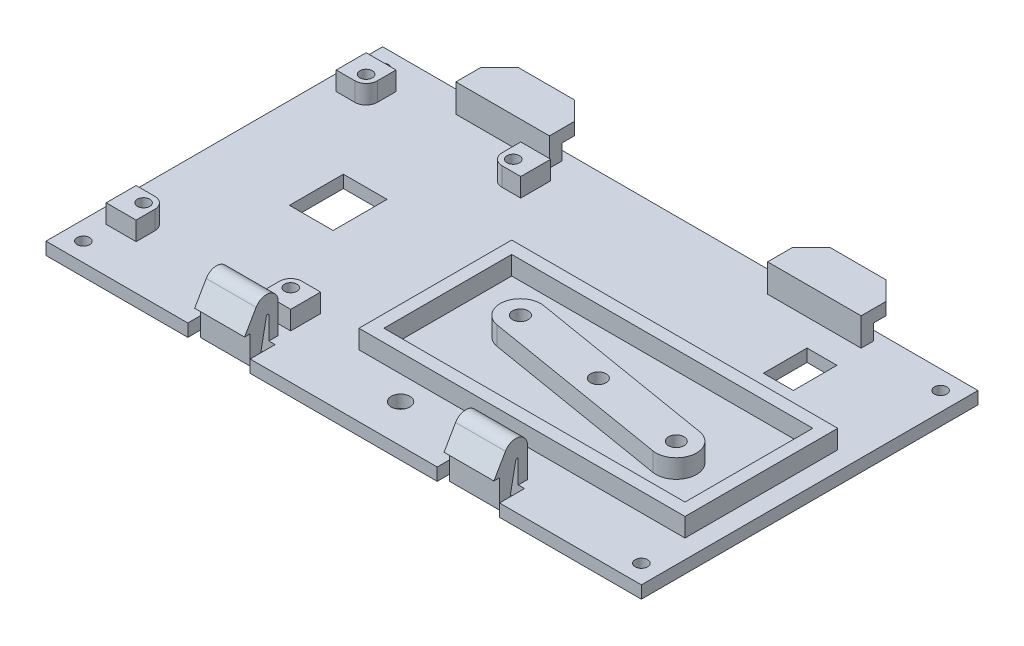
from build123d import *

# Parameters (mm, degrees)
SKETCH1_W            = 95.5
SKETCH1_H            = 54
BOSS_EXTRUDE1_DEPTH  = 2
SKETCH2_W            = 15
SKETCH2_H            = 2
BOSS_EXTRUDE2_DEPTH  = 2.5
SKETCH3_W            = 15
SKETCH3_H            = 7
BOSS_EXTRUDE3_DEPTH  = 2
CHAMFER1_SIZE        = 3
CUT_EXTRUDE1_REACH   = 59.031
SKETCH4_W            = 10
SKETCH4_H            = 4
BOSS_EXTRUDE4_DEPTH  = 4
FILLET1_R            = 1.901924
FILLET2_R            = 0.2
FILLET1_OF_MIRROR1_R = 1.901924
FILLET2_OF_MIRROR1_R = 0.2
CUT_EXTRUDE5_REACH   = 59.049
SKETCH12_R           = 1.5
SKETCH12_R_2         = 1
CUT_EXTRUDE6_REACH   = 59.049
SKETCH13_W           = 4.8
SKETCH13_H           = 7
CUT_EXTRUDE2_REACH   = 59.317
SKETCH8_W            = 7
SKETCH8_H            = 8.65
BOSS_EXTRUDE5_DEPTH  = 3
CUT_EXTRUDE3_REACH   = 60.049
CUT_EXTRUDE3_START   = 1
SKETCH9_3_R          = 1
SKETCH10_W           = 52.3
SKETCH10_H           = 24.5
SKETCH10_W_2         = 48.3
SKETCH10_H_2         = 20.5
BOSS_EXTRUDE6_DEPTH  = 3
CUT_EXTRUDE4_REACH   = 60.049
CUT_EXTRUDE4_START   = 1
SKETCH10_4_R         = 1.25


with BuildPart() as part:
    # Sketch1 → Boss-Extrude1 (new body)
    with BuildSketch(Plane(origin=(0, 0, 0), x_dir=(1, 0, 0), z_dir=(0, 1, 0))):
        Rectangle(SKETCH1_W, SKETCH1_H)
    extrude(amount=BOSS_EXTRUDE1_DEPTH)

    # Sketch2 → Boss-Extrude2 (add)
    with BuildSketch(Plane.XZ.offset(-2)):
        with Locations((-25, -24.5)):
            Rectangle(SKETCH2_W, SKETCH2_H)
        with Locations((25, -24.5)):
            Rectangle(SKETCH2_W, SKETCH2_H)
    extrude(amount=-BOSS_EXTRUDE2_DEPTH)

    # Sketch3 → Boss-Extrude3 (add)
    with BuildSketch(Plane(origin=(0, 4.5, 0), x_dir=(-1, 0, 0), z_dir=(0, 1, 0))):
        with Locations((-25, -27)):
            Rectangle(SKETCH3_W, SKETCH3_H)
        with Locations((25, -27)):
            Rectangle(SKETCH3_W, SKETCH3_H)
    extrude(amount=BOSS_EXTRUDE3_DEPTH)

    # Chamfer1
    chamfer1_edges = [part.edges().sort_by_distance(p)[0] for p in [
        (32.5, 5.5, -30.5),
        (17.5, 5.5, -30.5),
        (-17.5, 5.5, -30.5),
        (-32.5, 5.5, -30.5),
    ]]
    chamfer(chamfer1_edges, length=CHAMFER1_SIZE)

    # Sketch4 → Cut-Extrude1 (cut, up to next)
    with BuildSketch(Plane.XZ, mode=Mode.PRIVATE) as cut_extrude1_sk1:
        with Locations((-20, 25)):
            Rectangle(SKETCH4_W, SKETCH4_H)
    cut_extrude1_tool1 = extrude(cut_extrude1_sk1.sketch, amount=-CUT_EXTRUDE1_REACH, mode=Mode.PRIVATE) & part.part
    # Sketch4 → Cut-Extrude1 (cut, up to next)
    with BuildSketch(Plane.XZ, mode=Mode.PRIVATE) as cut_extrude1_sk2:
        with Locations((20, 25)):
            Rectangle(SKETCH4_W, SKETCH4_H)
    cut_extrude1_tool2 = extrude(cut_extrude1_sk2.sketch, amount=-CUT_EXTRUDE1_REACH, mode=Mode.PRIVATE) & part.part
    add(cut_extrude1_tool1.solids().sort_by_distance((-20, 0, 25))[0], mode=Mode.SUBTRACT)
    add(cut_extrude1_tool2.solids().sort_by_distance((20, 0, 25))[0], mode=Mode.SUBTRACT)

    # Sketch6 → Boss-Extrude4 (add, symmetric)
    with BuildSketch(Plane(origin=(-20, 0, 0), x_dir=(0, 0, -1), z_dir=(1, 0, 0))):
        Polygon((-21.5, 2), (-21.5, 8.656921938), (-24.5, 8.656921938), (-26, 6.058845727), (-26.9, 4.5), (-26, 4.5), (-26, 0), (-24.5, 0), (-23, 7.656921938), (-23, 2), align=None)
    boss_extrude4 = extrude(amount=BOSS_EXTRUDE4_DEPTH, both=True)

    # Fillet1
    fillet1_edges = [part.edges().sort_by_distance(p)[0] for p in [
        (-20, 8.656921938, 21.5),
        (-20, 8.656921938, 24.5),
    ]]
    fillet(fillet1_edges, radius=FILLET1_R - 0.0001)  # a hair under: the kernel refuses the full size

    # Fillet2
    fillet2_edges = [part.edges().sort_by_distance(p)[0] for p in [
        (-20, 7.656921938, 23),
    ]]
    fillet(fillet2_edges, radius=FILLET2_R)

    # Mirror1: Boss-Extrude4 across plane
    add(boss_extrude4.mirror(Plane(origin=(0, 0, 0), x_dir=(0, 0, 1), z_dir=(1, 0, 0))))

    # Fillet1 of Mirror1
    fillet1_of_mirror1_edges = [part.edges().sort_by_distance(p)[0] for p in [
        (20, 8.656921938, 21.5),
        (20, 8.656921938, 24.5),
    ]]
    fillet(fillet1_of_mirror1_edges, radius=FILLET1_OF_MIRROR1_R - 0.0001)  # a hair under: the kernel refuses the full size

    # Fillet2 of Mirror1
    fillet2_of_mirror1_edges = [part.edges().sort_by_distance(p)[0] for p in [
        (20, 7.656921938, 23),
    ]]
    fillet(fillet2_of_mirror1_edges, radius=FILLET2_OF_MIRROR1_R)

    # Sketch12 → Cut-Extrude5 (cut, up to next)
    with BuildSketch(Plane(origin=(0, 2, 0), x_dir=(1, 0, 0), z_dir=(0, 1, 0)), mode=Mode.PRIVATE) as cut_extrude5_sk1:
        with Locations(Location((2.9867, -20.8641, 0), (0, 0, 270))):
            Circle(SKETCH12_R)
    cut_extrude5_tool1 = extrude(cut_extrude5_sk1.sketch, amount=-CUT_EXTRUDE5_REACH, mode=Mode.PRIVATE) & part.part
    # Sketch12 → Cut-Extrude5 (cut, up to next)
    with BuildSketch(Plane(origin=(0, 2, 0), x_dir=(1, 0, 0), z_dir=(0, 1, 0)), mode=Mode.PRIVATE) as cut_extrude5_sk2:
        with Locations(Location((-44.75, -24, 0), (0, 0, 270))):
            Circle(SKETCH12_R_2)
    cut_extrude5_tool2 = extrude(cut_extrude5_sk2.sketch, amount=-CUT_EXTRUDE5_REACH, mode=Mode.PRIVATE) & part.part
    # Sketch12 → Cut-Extrude5 (cut, up to next)
    with BuildSketch(Plane(origin=(0, 2, 0), x_dir=(1, 0, 0), z_dir=(0, 1, 0)), mode=Mode.PRIVATE) as cut_extrude5_sk3:
        with Locations(Location((44.75, -24, 0), (0, 0, 270))):
            Circle(SKETCH12_R_2)
    cut_extrude5_tool3 = extrude(cut_extrude5_sk3.sketch, amount=-CUT_EXTRUDE5_REACH, mode=Mode.PRIVATE) & part.part
    # Sketch12 → Cut-Extrude5 (cut, up to next)
    with BuildSketch(Plane(origin=(0, 2, 0), x_dir=(1, 0, 0), z_dir=(0, 1, 0)), mode=Mode.PRIVATE) as cut_extrude5_sk4:
        with Locations(Location((-44.75, 24, 0), (0, 0, 270))):
            Circle(SKETCH12_R_2)
    cut_extrude5_tool4 = extrude(cut_extrude5_sk4.sketch, amount=-CUT_EXTRUDE5_REACH, mode=Mode.PRIVATE) & part.part
    # Sketch12 → Cut-Extrude5 (cut, up to next)
    with BuildSketch(Plane(origin=(0, 2, 0), x_dir=(1, 0, 0), z_dir=(0, 1, 0)), mode=Mode.PRIVATE) as cut_extrude5_sk5:
        with Locations(Location((44.75, 24, 0), (0, 0, 270))):
            Circle(SKETCH12_R_2)
    cut_extrude5_tool5 = extrude(cut_extrude5_sk5.sketch, amount=-CUT_EXTRUDE5_REACH, mode=Mode.PRIVATE) & part.part
    add(cut_extrude5_tool1.solids().sort_by_distance((2.9867, 2, 20.8641))[0], mode=Mode.SUBTRACT)
    add(cut_extrude5_tool2.solids().sort_by_distance((-44.75, 2, 24))[0], mode=Mode.SUBTRACT)
    add(cut_extrude5_tool3.solids().sort_by_distance((44.75, 2, 24))[0], mode=Mode.SUBTRACT)
    add(cut_extrude5_tool4.solids().sort_by_distance((-44.75, 2, -24))[0], mode=Mode.SUBTRACT)
    add(cut_extrude5_tool5.solids().sort_by_distance((44.75, 2, -24))[0], mode=Mode.SUBTRACT)

    # Sketch13 → Cut-Extrude6 (cut, up to next)
    with BuildSketch(Plane(origin=(0, 2, 0), x_dir=(1, 0, 0), z_dir=(0, 1, 0)), mode=Mode.PRIVATE) as cut_extrude6_sk1:
        with Locations((30.5407, 15.6841)):
            Rectangle(SKETCH13_W, SKETCH13_H)
    cut_extrude6_tool1 = extrude(cut_extrude6_sk1.sketch, amount=-CUT_EXTRUDE6_REACH, mode=Mode.PRIVATE) & part.part
    add(cut_extrude6_tool1.solids().sort_by_distance((30.5407, 2, -15.6841))[0], mode=Mode.SUBTRACT)

    # Sketch8 → Cut-Extrude2 (cut, up to next)
    with BuildSketch(Plane.XZ, mode=Mode.PRIVATE) as cut_extrude2_sk1:
        with Locations((-29.7, -1.825)):
            Rectangle(SKETCH8_W, SKETCH8_H)
    cut_extrude2_tool1 = extrude(cut_extrude2_sk1.sketch, amount=-CUT_EXTRUDE2_REACH, mode=Mode.PRIVATE) & part.part
    add(cut_extrude2_tool1.solids().sort_by_distance((-29.7, 0, -1.825))[0], mode=Mode.SUBTRACT)

    # Sketch9 → Boss-Extrude5 (add)
    with BuildSketch(Plane(origin=(0, 2, 0), x_dir=(1, 0, 0), z_dir=(0, 1, 0))):
        with BuildLine():
            Line((-45.25, -15.05), (-45.25, -19.85))
            Line((-45.25, -19.85), (-40.45, -19.85))
            Line((-40.45, -19.85), (-40.45, -16.85))
            ThreePointArc((-40.45, -16.85), (-40.977207794, -15.577207794), (-42.25, -15.05))
            Line((-42.25, -15.05), (-45.25, -15.05))
        make_face()
        with BuildLine():
            Line((-15.65, -15.05), (-18.65, -15.05))
            ThreePointArc((-18.65, -15.05), (-19.922792206, -15.577207794), (-20.45, -16.85))
            Line((-20.45, -16.85), (-20.45, -19.85))
            Line((-20.45, -19.85), (-15.65, -19.85))
            Line((-15.65, -19.85), (-15.65, -15.05))
        make_face()
        with BuildLine():
            Line((-45.25, 17.05), (-42.25, 17.05))
            ThreePointArc((-42.25, 17.05), (-40.977207794, 17.577207794), (-40.45, 18.85))
            Line((-40.45, 18.85), (-40.45, 21.85))
            Line((-40.45, 21.85), (-45.25, 21.85))
            Line((-45.25, 21.85), (-45.25, 17.05))
        make_face()
        with BuildLine():
            Line((-15.65, 17.05), (-15.65, 21.85))
            Line((-15.65, 21.85), (-20.45, 21.85))
            Line((-20.45, 21.85), (-20.45, 18.85))
            ThreePointArc((-20.45, 18.85), (-19.922792206, 17.577207794), (-18.65, 17.05))
            Line((-18.65, 17.05), (-15.65, 17.05))
        make_face()
    extrude(amount=BOSS_EXTRUDE5_DEPTH)

    # Sketch9<3> → Cut-Extrude3 (cut, up to next)
    with BuildSketch(Plane(origin=(0, 2, 0), x_dir=(1, 0, 0), z_dir=(0, 1, 0)).offset(CUT_EXTRUDE3_START), mode=Mode.PRIVATE) as cut_extrude3_sk1:
        with Locations(Location((-42.25, -16.85, 0), (0, 0, 270))):
            Circle(SKETCH9_3_R)
    cut_extrude3_tool1 = extrude(cut_extrude3_sk1.sketch, amount=CUT_EXTRUDE3_REACH, mode=Mode.PRIVATE) & part.part
    # Sketch9<3> → Cut-Extrude3 (cut, up to next)
    with BuildSketch(Plane(origin=(0, 2, 0), x_dir=(1, 0, 0), z_dir=(0, 1, 0)).offset(CUT_EXTRUDE3_START), mode=Mode.PRIVATE) as cut_extrude3_sk2:
        with Locations(Location((-18.65, -16.85, 0), (0, 0, 90))):
            Circle(SKETCH9_3_R)
    cut_extrude3_tool2 = extrude(cut_extrude3_sk2.sketch, amount=CUT_EXTRUDE3_REACH, mode=Mode.PRIVATE) & part.part
    # Sketch9<3> → Cut-Extrude3 (cut, up to next)
    with BuildSketch(Plane(origin=(0, 2, 0), x_dir=(1, 0, 0), z_dir=(0, 1, 0)).offset(CUT_EXTRUDE3_START), mode=Mode.PRIVATE) as cut_extrude3_sk3:
        with Locations(Location((-42.25, 18.85, 0), (0, 0, 90))):
            Circle(SKETCH9_3_R)
    cut_extrude3_tool3 = extrude(cut_extrude3_sk3.sketch, amount=CUT_EXTRUDE3_REACH, mode=Mode.PRIVATE) & part.part
    # Sketch9<3> → Cut-Extrude3 (cut, up to next)
    with BuildSketch(Plane(origin=(0, 2, 0), x_dir=(1, 0, 0), z_dir=(0, 1, 0)).offset(CUT_EXTRUDE3_START), mode=Mode.PRIVATE) as cut_extrude3_sk4:
        with Locations(Location((-18.65, 18.85, 0), (0, 0, 270))):
            Circle(SKETCH9_3_R)
    cut_extrude3_tool4 = extrude(cut_extrude3_sk4.sketch, amount=CUT_EXTRUDE3_REACH, mode=Mode.PRIVATE) & part.part
    add(cut_extrude3_tool1.solids().sort_by_distance((-42.25, 3, 16.85))[0], mode=Mode.SUBTRACT)
    add(cut_extrude3_tool2.solids().sort_by_distance((-18.65, 3, 16.85))[0], mode=Mode.SUBTRACT)
    add(cut_extrude3_tool3.solids().sort_by_distance((-42.25, 3, -18.85))[0], mode=Mode.SUBTRACT)
    add(cut_extrude3_tool4.solids().sort_by_distance((-18.65, 3, -18.85))[0], mode=Mode.SUBTRACT)

    # Sketch10 → Boss-Extrude6 (add)
    # profile 1 of 2: a face of its own
    with BuildSketch(Plane(origin=(0, 2, 0), x_dir=(1, 0, 0), z_dir=(0, 1, 0))):
        with Locations((18.6, -4.75)):
            Rectangle(SKETCH10_W, SKETCH10_H)
        with Locations((18.6, -4.75)):
            Rectangle(SKETCH10_W_2, SKETCH10_H_2, mode=Mode.SUBTRACT)
    # profile 2 of 2: a face of its own
    with BuildSketch(Plane(origin=(0, 2, 0), x_dir=(1, 0, 0), z_dir=(0, 1, 0))):
        with BuildLine():
            Line((4.134296709, 0.955780252), (34.134296709, -4.044219748))
            ThreePointArc((34.134296709, -4.044219748), (36.805780252, -7.784296709), (33.065703291, -10.455780252))
            Line((33.065703291, -10.455780252), (3.065703291, -5.455780252))
            ThreePointArc((3.065703291, -5.455780252), (0.394219748, -1.715703291), (4.134296709, 0.955780252))
        make_face()
    extrude(amount=BOSS_EXTRUDE6_DEPTH)

    # Sketch10<4> → Cut-Extrude4 (cut, up to next)
    with BuildSketch(Plane(origin=(0, 2, 0), x_dir=(1, 0, 0), z_dir=(0, 1, 0)).offset(CUT_EXTRUDE4_START), mode=Mode.PRIVATE) as cut_extrude4_sk1:
        with Locations(Location((18.6, -4.75, 0), (0, 0, 270))):
            Circle(SKETCH10_4_R)
    cut_extrude4_tool1 = extrude(cut_extrude4_sk1.sketch, amount=CUT_EXTRUDE4_REACH, mode=Mode.PRIVATE) & part.part
    # Sketch10<4> → Cut-Extrude4 (cut, up to next)
    with BuildSketch(Plane(origin=(0, 2, 0), x_dir=(1, 0, 0), z_dir=(0, 1, 0)).offset(CUT_EXTRUDE4_START), mode=Mode.PRIVATE) as cut_extrude4_sk2:
        with Locations(Location((3.6, -2.25, 0), (0, 0, 270))):
            Circle(SKETCH10_4_R)
    cut_extrude4_tool2 = extrude(cut_extrude4_sk2.sketch, amount=CUT_EXTRUDE4_REACH, mode=Mode.PRIVATE) & part.part
    # Sketch10<4> → Cut-Extrude4 (cut, up to next)
    with BuildSketch(Plane(origin=(0, 2, 0), x_dir=(1, 0, 0), z_dir=(0, 1, 0)).offset(CUT_EXTRUDE4_START), mode=Mode.PRIVATE) as cut_extrude4_sk3:
        with Locations(Location((33.6, -7.25, 0), (0, 0, 270))):
            Circle(SKETCH10_4_R)
    cut_extrude4_tool3 = extrude(cut_extrude4_sk3.sketch, amount=CUT_EXTRUDE4_REACH, mode=Mode.PRIVATE) & part.part
    add(cut_extrude4_tool1.solids().sort_by_distance((18.6, 3, 4.75))[0], mode=Mode.SUBTRACT)
    add(cut_extrude4_tool2.solids().sort_by_distance((3.6, 3, 2.25))[0], mode=Mode.SUBTRACT)
    add(cut_extrude4_tool3.solids().sort_by_distance((33.6, 3, 7.25))[0], mode=Mode.SUBTRACT)


solid = part.part
